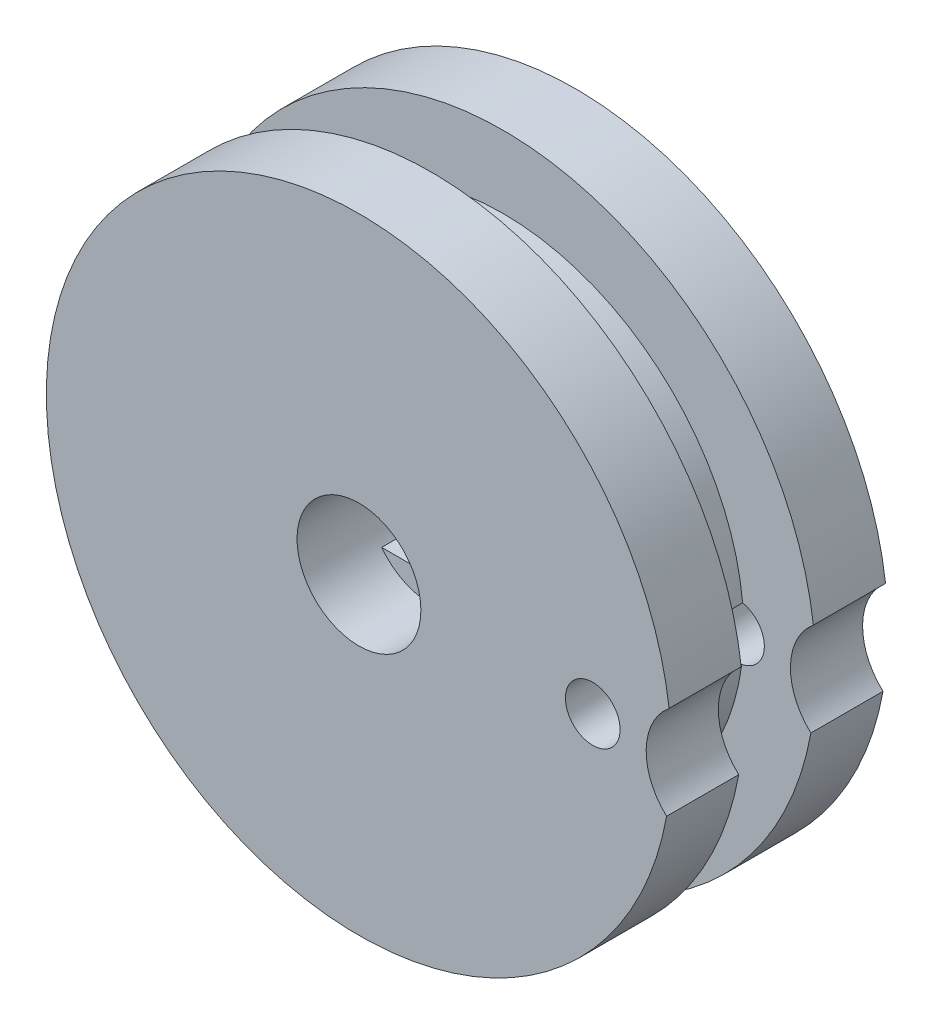
from build123d import *
from build123d.topology import SkipClean

# Parameters (mm, degrees)
SKETCH1_R               = 13
SKETCH1_R_2             = 10
SKETCH1_R_3             = 2.575
BOSS_EXTRUDE4_DEPTH     = 3
BOSS_EXTRUDE5_START     = 3
SKETCH5_R               = 10
BOSS_EXTRUDE5_DEPTH     = 3
BOSS_EXTRUDE6_OUTLINE_R = 13
BOSS_EXTRUDE6_DEPTH     = 3
SKETCH8_R               = 1.136174382
SKETCH8_R_2             = 2.601730121
CUT_EXTRUDE2_DEPTH      = 14


# Read off the part's stored shape, not the designer's step: Boss-Extrude6
with BuildPart() as part:
    # Sketch1 → Boss-Extrude4 (new body)
    # profile 1 of 2: a face of its own
    with BuildSketch(Plane.XY):
        Circle(SKETCH1_R)
        Circle(SKETCH1_R_2, mode=Mode.SUBTRACT)
    # profile 2 of 2: a face of its own
    with BuildSketch(Plane.XY):
        Circle(SKETCH1_R_2)
        Circle(SKETCH1_R_3, mode=Mode.SUBTRACT)
    extrude(amount=BOSS_EXTRUDE4_DEPTH)

    # Sketch5 → Boss-Extrude5 (add)
    with SkipClean():  # the faces are left unmerged after this step: merging them gives an invalid solid
        with BuildSketch(Plane(origin=(0, 0, 0), x_dir=(-1, 0, 0), z_dir=(0, 0, -1)).offset(BOSS_EXTRUDE5_START)):
            Circle(SKETCH5_R)
            with BuildLine():
                Line((2.056240501, 1.55), (-2.056240501, 1.55))
                ThreePointArc((-2.056240501, 1.55), (-2.575, 0), (-2.056240501, -1.55))
                Line((-2.056240501, -1.55), (2.056240501, -1.55))
                ThreePointArc((2.056240501, -1.55), (2.575, 0), (2.056240501, 1.55))
            make_face(mode=Mode.SUBTRACT)
        extrude(amount=-BOSS_EXTRUDE5_DEPTH)

    # Boss-Extrude6 outline → Boss-Extrude6 (add)
    with SkipClean():  # the faces are left unmerged after this step: merging them gives an invalid solid
        with BuildSketch(Plane(origin=(0, 0, -3), x_dir=(-1, 0, 0), z_dir=(0, 0, -1))):
            Circle(BOSS_EXTRUDE6_OUTLINE_R)
            with BuildLine():
                Line((-2.056240501, 1.55), (2.056240501, 1.55))
                ThreePointArc((2.056240501, 1.55), (2.575, 0), (2.056240501, -1.55))
                Line((2.056240501, -1.55), (-2.056240501, -1.55))
                ThreePointArc((-2.056240501, -1.55), (-2.575, 0), (-2.056240501, 1.55))
            make_face(mode=Mode.SUBTRACT)
        extrude(amount=BOSS_EXTRUDE6_DEPTH)

    # Sketch8 → Cut-Extrude2 (cut)
    with SkipClean():  # the faces are left unmerged after this step: merging them gives an invalid solid
        with BuildSketch(Plane.XY.offset(3)):
            with Locations((9.721913819, -0.155301554)):
                Circle(SKETCH8_R)
            with Locations((14.544737257, -0.386006821)):
                Circle(SKETCH8_R_2)
        extrude(amount=-CUT_EXTRUDE2_DEPTH, mode=Mode.SUBTRACT)


solid = part.part
